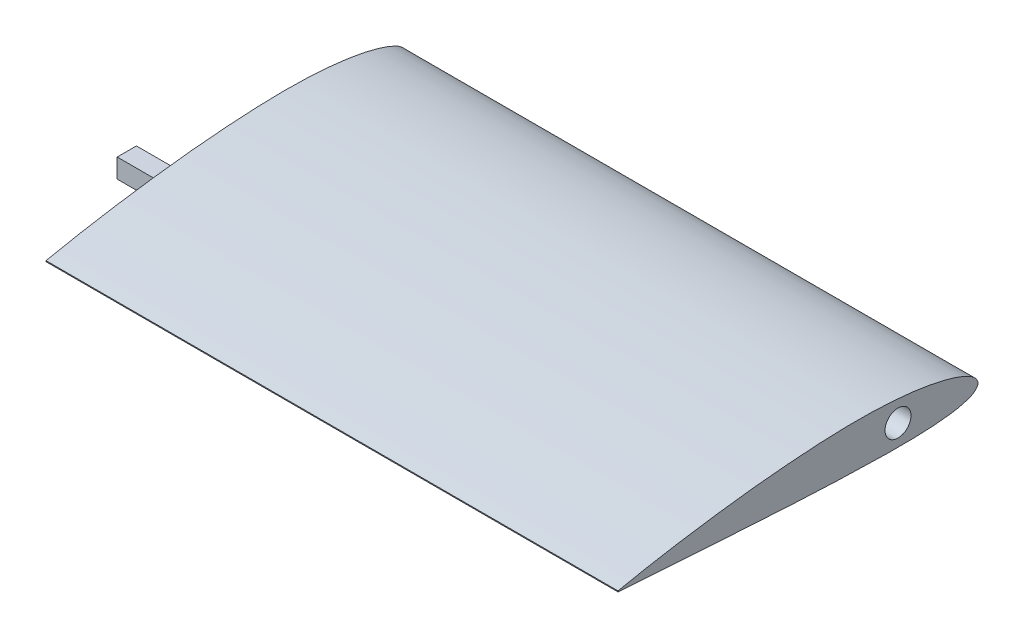
from build123d import *

# Parameters (mm, degrees)
EXTERIOR_DEPTH          = 90
BOSS_EXTRUDE1_DEPTH     = 15
CUT_EXTRUDE1_DEPTH      = 187.882316063
BOSS_EXTRUDE2_DEPTH     = 143
CUT_EXTRUDE6_DEPTH      = 187.015325322
CUT_EXTRUDE2_DEPTH      = 172.341849716
CUT_EXTRUDE2_DEPTH_BACK = 172.341849716
SKETCH13_R              = 3.25
SKETCH19_W              = 4.8
SKETCH19_H              = 4.8
BOSS_EXTRUDE3_DEPTH     = 9.8


with BuildPart() as part:
    # Sketch4 → Exterior (new body)
    with BuildSketch(Plane.XY):
        with BuildLine():
            Line((-30.310889132, 17.5), (30.310889132, 17.5))
            ThreePointArc((30.310889132, 17.5), (0, 35), (-30.310889132, 17.5))
        make_face()
    extrude(amount=EXTERIOR_DEPTH)

    # Sketch5 → Boss-Extrude1 (add)
    with BuildSketch(Plane(origin=(0, 0, 0), x_dir=(-1, 0, 0), z_dir=(0, 0, -1))):
        with BuildLine():
            Line((23.12466216, 17.5), (-23.12466216, 17.5))
            ThreePointArc((-23.12466216, 17.5), (0, 29), (23.12466216, 17.5))
        make_face()
    extrude(amount=BOSS_EXTRUDE1_DEPTH)

    # Sketch8 → Loft9 section 0
    with BuildSketch(Plane(origin=(80, 0, 0), x_dir=(0, 0, -1), z_dir=(1, 0, 0))):
        with BuildLine():
            Line((-90, 21.432366243), (-90, 21.198382159))
            add(Edge.make_bspline(
                [(-90, 21.432366243), (-88.500933926, 21.739545374), (-85.506738957, 22.353096852), (-79.513207025, 23.476900974), (-72.017254902, 24.722076868), (-63.016159498, 26.010803551), (-54.016548901, 27.085553985), (-45.013036623, 27.872502339), (-36.011574753, 28.405421098), (-28.501382509, 28.495628322), (-22.499148056, 28.247142418), (-17.99379134, 27.883038763), (-13.482746661, 27.306456938), (-9.728435841, 26.596441021), (-6.735425578, 25.793161808), (-4.466301103, 25.062862179), (-2.543789771, 24.211953422), (-0.885448876, 23.18032068), (0.560680661, 21.396258105), (-0.941462624, 19.828099306), (-2.568784612, 19.112875936), (-4.482837902, 18.569587924), (-6.74449179, 18.180048952), (-9.749480667, 17.847620831), (-13.500436316, 17.59175521), (-18.004367236, 17.489171146), (-22.5050837, 17.50346658), (-28.505231535, 17.63591039), (-36.00611648, 17.874235378), (-45.006065516, 18.288993082), (-54.003404842, 18.828075055), (-63.002270201, 19.388407607), (-72.00267421, 19.955585158), (-79.500543105, 20.477953196), (-85.500687681, 20.880865225), (-88.500160566, 21.092538335), (-90, 21.198382159)],
                knots=[0, 0, 0, 0, 0.02501249, 0.049959286, 0.099672925, 0.14920632, 0.198581097, 0.24780517, 0.296916575, 0.345952722, 0.370491626, 0.395091204, 0.419814796, 0.444798575, 0.457489819, 0.470406405, 0.483879409, 0.49126412, 0.503458853, 0.513609129, 0.520450991, 0.533235388, 0.545691039, 0.558031884, 0.582609167, 0.607134742, 0.63165208, 0.656174272, 0.705233949, 0.754320379, 0.803437364, 0.852566096, 0.901700994, 0.950848809, 0.975422717, 1, 1, 1, 1], degree=3))
        make_face()
    # Sketch9 → Loft9 section 1
    with BuildSketch(Plane(origin=(-80, 0, 0), x_dir=(0, 0, -1), z_dir=(1, 0, 0))):
        with BuildLine():
            Line((-90, 21.432366243), (-90, 21.198382159))
            add(Edge.make_bspline(
                [(-90, 21.432366243), (-88.500933926, 21.739545374), (-85.506738957, 22.353096852), (-79.513207025, 23.476900974), (-72.017254902, 24.722076868), (-63.016159498, 26.010803551), (-54.016548901, 27.085553985), (-45.013036623, 27.872502339), (-36.011574753, 28.405421098), (-28.501382509, 28.495628322), (-22.499148056, 28.247142418), (-17.99379134, 27.883038763), (-13.482746661, 27.306456938), (-9.728435841, 26.596441021), (-6.735425578, 25.793161808), (-4.466301103, 25.062862179), (-2.543789771, 24.211953422), (-0.885448876, 23.18032068), (0.560680661, 21.396258105), (-0.941462624, 19.828099306), (-2.568784612, 19.112875936), (-4.482837902, 18.569587924), (-6.74449179, 18.180048952), (-9.749480667, 17.847620831), (-13.500436316, 17.59175521), (-18.004367236, 17.489171146), (-22.5050837, 17.50346658), (-28.505231535, 17.63591039), (-36.00611648, 17.874235378), (-45.006065516, 18.288993082), (-54.003404842, 18.828075055), (-63.002270201, 19.388407607), (-72.00267421, 19.955585158), (-79.500543105, 20.477953196), (-85.500687681, 20.880865225), (-88.500160566, 21.092538335), (-90, 21.198382159)],
                knots=[0, 0, 0, 0, 0.02501249, 0.049959286, 0.099672925, 0.14920632, 0.198581097, 0.24780517, 0.296916575, 0.345952722, 0.370491626, 0.395091204, 0.419814796, 0.444798575, 0.457489819, 0.470406405, 0.483879409, 0.49126412, 0.503458853, 0.513609129, 0.520450991, 0.533235388, 0.545691039, 0.558031884, 0.582609167, 0.607134742, 0.63165208, 0.656174272, 0.705233949, 0.754320379, 0.803437364, 0.852566096, 0.901700994, 0.950848809, 0.975422717, 1, 1, 1, 1], degree=3))
        make_face()
    loft()

    # Sketch12 → Cut-Extrude1 (cut, through all)
    with BuildSketch(Plane(origin=(80, 0, 0), x_dir=(0, 0, -1), z_dir=(1, 0, 0))):
        with BuildLine():
            add(Edge.make_bspline(
                [(-90, 21.432366243), (-88.517970234, 21.737980939), (-85.557803137, 22.348407657), (-79.632256681, 23.467116444), (-72.221134443, 24.707701375), (-63.321647609, 25.993209562), (-54.423365173, 27.067117347), (-45.520869444, 27.856425887), (-37.923196081, 28.315745298), (-33.290343793, 28.425153226), (-31.628845216, 28.436220013)],
                knots=[0, 0, 0, 0, 0.02501249, 0.049959286, 0.099672925, 0.14920632, 0.198581097, 0.24780517, 0.296916575, 0.324376959, 0.324376959, 0.324376959, 0.324376959], degree=3))
            add(Edge.make_bspline(
                [(-90, 21.432366243), (-88.500933926, 21.739545374), (-85.506738957, 22.353096852), (-79.513207025, 23.476900974), (-72.017254902, 24.722076868), (-63.016159498, 26.010803551), (-54.016548901, 27.085553985), (-45.013036623, 27.872502339), (-37.550589404, 28.314305923), (-33.087456779, 28.421897917), (-31.628845216, 28.436220013)],
                knots=[0, 0, 0, 0, 0.02501249, 0.049959286, 0.099672925, 0.14920632, 0.198581097, 0.24780517, 0.296916575, 0.320756027, 0.320756027, 0.320756027, 0.320756027], degree=3))
        make_face()
        with BuildLine():
            Line((-97.240851338, 26.906548897), (-90, 21.432366243))
            add(Edge.make_bspline(
                [(-90, 21.432366243), (-88.517970234, 21.737980939), (-85.557803137, 22.348407657), (-79.632256681, 23.467116444), (-72.221134443, 24.707701375), (-63.321647609, 25.993209562), (-54.423365173, 27.067117347), (-45.520869444, 27.856425887), (-37.923196081, 28.315745298), (-33.290343793, 28.425153226), (-31.628845216, 28.436220013)],
                knots=[0, 0, 0, 0, 0.02501249, 0.049959286, 0.099672925, 0.14920632, 0.198581097, 0.24780517, 0.296916575, 0.324376959, 0.324376959, 0.324376959, 0.324376959], degree=3))
            Line((-31.628845216, 28.436220013), (-0.011306323, 30.013384743))
            Line((-0.011306323, 30.013384743), (6.418630162, 38.518437853))
            Line((6.418630162, 38.518437853), (-30.113825381, 44.023328414))
            Line((-30.113825381, 44.023328414), (-90.292288108, 42.772216923))
            Line((-90.292288108, 42.772216923), (-97.240851338, 26.906548897))
        make_face()
    extrude(amount=-CUT_EXTRUDE1_DEPTH, mode=Mode.SUBTRACT)

    # Sketch17 → Boss-Extrude2 (add)
    with BuildSketch(Plane.ZY.offset(80)):
        with BuildLine():
            Line((90, 21.432366243), (90, 21.198382159))
            add(Edge.make_bspline(
                [(90, 21.432366243), (88.500933926, 21.739545374), (85.506738957, 22.353096852), (79.513207025, 23.476900974), (72.017254902, 24.722076868), (63.016159498, 26.010803551), (54.016548901, 27.085553985), (45.013036623, 27.872502339), (36.011574753, 28.405421098), (28.501382509, 28.495628322), (22.499148056, 28.247142418), (17.99379134, 27.883038763), (13.482746661, 27.306456938), (9.728435841, 26.596441021), (6.735425578, 25.793161808), (4.466301103, 25.062862179), (2.543789771, 24.211953422), (0.885448876, 23.18032068), (-0.560680661, 21.396258105), (0.941462624, 19.828099306), (2.568784612, 19.112875936), (4.482837902, 18.569587924), (6.74449179, 18.180048952), (9.749480667, 17.847620831), (13.500436316, 17.59175521), (18.004367236, 17.489171146), (22.5050837, 17.50346658), (28.505231535, 17.63591039), (36.00611648, 17.874235378), (45.006065516, 18.288993082), (54.003404842, 18.828075055), (63.002270201, 19.388407607), (72.00267421, 19.955585158), (79.500543105, 20.477953196), (85.500687681, 20.880865225), (88.500160566, 21.092538335), (90, 21.198382159)],
                knots=[0, 0, 0, 0, 0.02501249, 0.049959286, 0.099672925, 0.14920632, 0.198581097, 0.24780517, 0.296916575, 0.345952722, 0.370491626, 0.395091204, 0.419814796, 0.444798575, 0.457489819, 0.470406405, 0.483879409, 0.49126412, 0.503458853, 0.513609129, 0.520450991, 0.533235388, 0.545691039, 0.558031884, 0.582609167, 0.607134742, 0.63165208, 0.656174272, 0.705233949, 0.754320379, 0.803437364, 0.852566096, 0.901700994, 0.950848809, 0.975422717, 1, 1, 1, 1], degree=3))
        make_face()
    extrude(amount=BOSS_EXTRUDE2_DEPTH)

    # Sketch18 → Cut-Extrude6 (cut, through all)
    with BuildSketch(Plane(origin=(-80, 0, 0), x_dir=(0, 0, -1), z_dir=(1, 0, 0))):
        Polygon((-99.866971184, 5.715372229), (-104.390100049, 63.325750406), (31.898914441, 60.82612656), (39.278756274, -3.211855795), align=None)
    extrude(amount=CUT_EXTRUDE6_DEPTH, mode=Mode.SUBTRACT)

    # Sketch13 → Cut-Extrude2 (cut, two sides: drawn at the far end of the back side and taken through both)
    with BuildSketch(Plane.ZY.offset(80).offset(-CUT_EXTRUDE2_DEPTH_BACK)):
        with Locations((20, 22.7683278)):
            Circle(SKETCH13_R)
    extrude(amount=CUT_EXTRUDE2_DEPTH + CUT_EXTRUDE2_DEPTH_BACK, mode=Mode.SUBTRACT)

    # Sketch19 → Boss-Extrude3 (add)
    with BuildSketch(Plane.ZY.offset(223)):
        with Locations((60, 22.7683278)):
            Rectangle(SKETCH19_W, SKETCH19_H)
    extrude(amount=BOSS_EXTRUDE3_DEPTH)


solid = part.part
